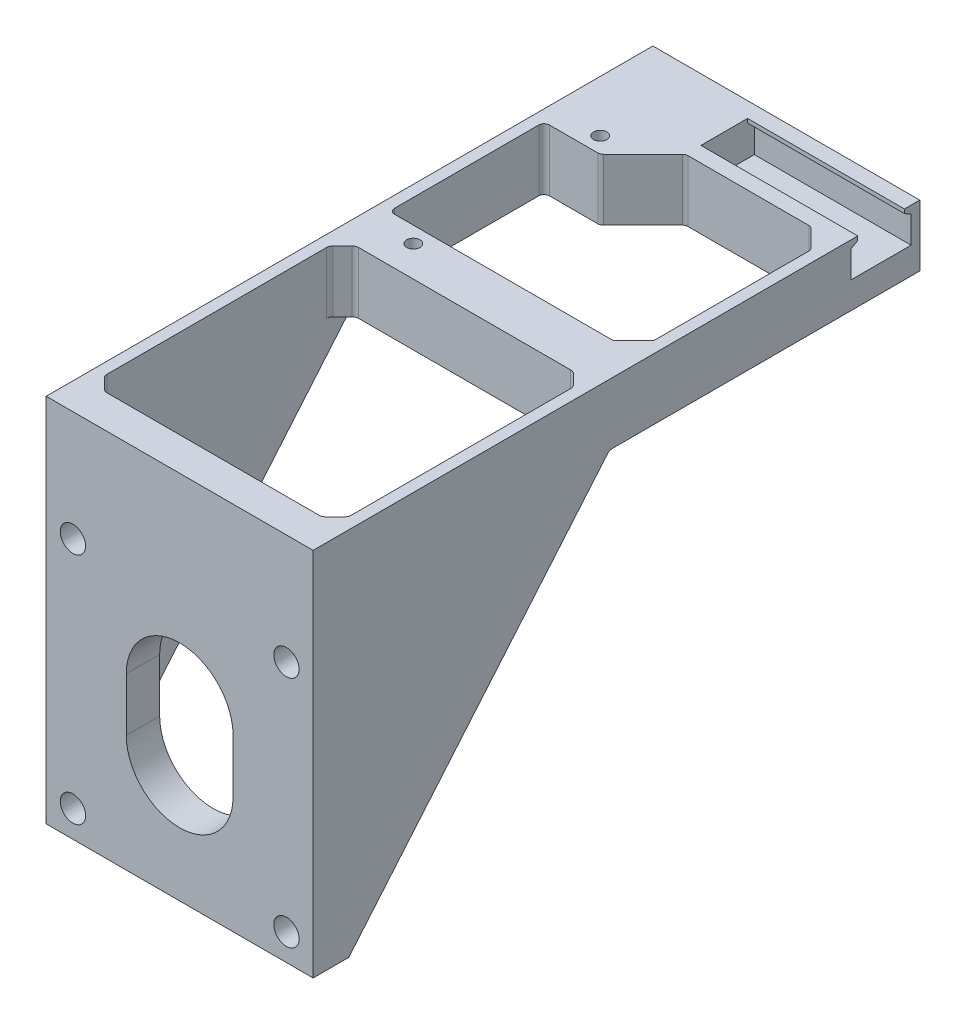
from build123d import *

# Parameters (mm, degrees)
BOSS_EXTRUDE1_START      = -1
SKETCH1_W                = 1.7
SKETCH1_H                = 89.2
BOSS_EXTRUDE1_DEPTH      = 9.2
SKETCH4_W                = 40
SKETCH4_H                = 11.6
BOSS_EXTRUDE3_DEPTH      = 9.2
SERVO_HOLDER_DEPTH       = 1
SERVO_HOLDER_DEPTH_BACK  = 9.2
SKETCH3_W                = 14
SKETCH3_H                = 7
SKETCH3_R                = 1
SKETCH37_W               = 26
SKETCH37_H               = 7
BOSS_EXTRUDE19_DEPTH     = 10.2
CUT_EXTRUDE10_DEPTH      = 93.482268571
CUT_EXTRUDE10_DEPTH_BACK = 93.482268571
SKETCH29_W               = 49.101454262
SKETCH29_H               = 5.977389624
BOSS_EXTRUDE17_DEPTH     = 3
SKETCH39_W               = 1.7
SKETCH39_H               = 41.2
BOSS_EXTRUDE20_DEPTH     = 9.2
CUT_EXTRUDE13_DEPTH      = 23.5
CHAMFER2_SIZE            = 0.6
CHAMFER2_SIZE_2          = 1.039230485
CHAMFER3_SIZE            = 3
CHAMFER4_SIZE            = 2.5
CUT_EXTRUDE16_DEPTH      = 10
FILLET11_R               = 0.8
SKETCH51_W               = 40
SKETCH51_H               = 41
CUT_EXTRUDE17_DEPTH      = 10
SKETCH50_W               = 40
SKETCH50_H               = 55.5
SKETCH50_R               = 1.9
BOSS_EXTRUDE24_DEPTH     = 5
SKETCH53_W               = 1.7
SKETCH53_H               = 37.711538462
BOSS_EXTRUDE25_DEPTH     = 9.2
CHAMFER6_START           = -21.7
CHAMFER6_DEPTH           = 1.7
CHAMFER6_START_2         = 16.6
CHAMFER6_2_DEPTH         = 1.7
CHAMFER5_SIZE            = 2
FILLET13_R               = 1


with BuildPart() as part:
    # Sketch1 → Boss-Extrude1 (new body)
    with BuildSketch(Plane(origin=(0, 0, 0), x_dir=(1, 0, 0), z_dir=(0, 1, 0)).offset(BOSS_EXTRUDE1_START)):
        with Locations((-20.85, 25.311538462)):
            Rectangle(SKETCH1_W, SKETCH1_H)
    extrude(amount=-BOSS_EXTRUDE1_DEPTH)

    # Sketch4 → Boss-Extrude3 (add)
    with BuildSketch(Plane.XZ.offset(10.2)):
        with Locations((-1.7, -64.111538462)):
            Rectangle(SKETCH4_W, SKETCH4_H)
    extrude(amount=-BOSS_EXTRUDE3_DEPTH)

    # Sketch3 → Servo Holder (add, two sides: drawn at the far end of the back side and taken through both)
    # profile 1 of 2: a face of its own
    with BuildSketch(Plane.XZ.offset(10.2).offset(-SERVO_HOLDER_DEPTH_BACK)):
        with Locations((-14.7, -55.411538462)):
            Rectangle(SKETCH3_W, SKETCH3_H)
        with Locations(Location((-14, -54.311538462, 0), (0, 0, 270))):
            Circle(SKETCH3_R, mode=Mode.SUBTRACT)
    # profile 2 of 2: a face of its own
    with BuildSketch(Plane.XZ.offset(10.2).offset(-SERVO_HOLDER_DEPTH_BACK)):
        with Locations((-14.7, -25.211538462)):
            Rectangle(SKETCH3_W, SKETCH3_H)
        with Locations(Location((-14, -26.311538462, 0), (0, 0, 90))):
            Circle(SKETCH3_R, mode=Mode.SUBTRACT)
    extrude(amount=SERVO_HOLDER_DEPTH + SERVO_HOLDER_DEPTH_BACK)

    # Sketch37 → Boss-Extrude19 (add)
    with BuildSketch(Plane(origin=(0, -1, 0), x_dir=(1, 0, 0), z_dir=(0, 1, 0))):
        with Locations((5.3, 25.211538462)):
            Rectangle(SKETCH37_W, SKETCH37_H)
    extrude(amount=-BOSS_EXTRUDE19_DEPTH)

    # Sketch29 → Cut-Extrude10 (cut, two sides: drawn at the far end of the back side and taken through both)
    with BuildSketch(Plane(origin=(0, 0, -69.911538462), x_dir=(-1, 0, 0), z_dir=(0, 0, -1)).offset(-CUT_EXTRUDE10_DEPTH_BACK)):
        with Locations((-2.850727131, -13.188694812)):
            Rectangle(SKETCH29_W, SKETCH29_H)
    extrude(amount=CUT_EXTRUDE10_DEPTH + CUT_EXTRUDE10_DEPTH_BACK, mode=Mode.SUBTRACT)

    # Sketch35 → Boss-Extrude17 (add)
    with BuildSketch(Plane(origin=(18.3, 0, 0), x_dir=(0, 0, -1), z_dir=(1, 0, 0))):
        Polygon((-2, -1), (21.711538462, -1), (21.711538462, -10.2), (-19.288461538, -10.2), (-19.288461538, -1), align=None)
    extrude(amount=-BOSS_EXTRUDE17_DEPTH)

    # Sketch39 → Boss-Extrude20 (add)
    with BuildSketch(Plane(origin=(0, -1, 0), x_dir=(1, 0, 0), z_dir=(0, 1, 0))):
        with Locations((17.45, 49.311538462)):
            Rectangle(SKETCH39_W, SKETCH39_H)
    extrude(amount=-BOSS_EXTRUDE20_DEPTH)

    # Sketch40 → Cut-Extrude13 (cut)
    with BuildSketch(Plane(origin=(18.3, 0, 0), x_dir=(0, 0, -1), z_dir=(1, 0, 0))):
        Polygon((64.111538462, -1), (60.611538462, -1), (60.611538462, -2.2), (59.611538462, -2.2), (59.611538462, -6.2), (64.111538462, -6.2), align=None)
        Polygon((67.611538462, -1), (64.111538462, -1), (64.111538462, -6.2), (68.611538462, -6.2), (68.611538462, -2.2), (67.611538462, -2.2), align=None)
    extrude(amount=-CUT_EXTRUDE13_DEPTH, mode=Mode.SUBTRACT)

    # Chamfer2
    # the kernel refuses this chamfer: 1.039230485, 0.6 mm, written as the material it takes off along each edge
    with BuildSketch(Plane(origin=(20.988578382, -2.2, -60.611538462), x_dir=(0, 1, 0), z_dir=(-1, 0, 0))) as chamfer2_piece_1_section:
        Polygon((CHAMFER2_SIZE, 0), (0, -CHAMFER2_SIZE_2), (0, 0), align=None)
    chamfer2_piece_1 = extrude(amount=26.188578382, mode=Mode.PRIVATE)
    chamfer2_piece_1 = split(chamfer2_piece_1, bisect_by=Plane(origin=(20.988578382, -2.2, -59.611538462), z_dir=(0, 0, -1)), keep=Keep.TOP, mode=Mode.PRIVATE)
    add(chamfer2_piece_1, mode=Mode.SUBTRACT)
    with BuildSketch(Plane(origin=(20.988578382, -2.2, -67.611538462), x_dir=(0, 1, 0), z_dir=(-1, 0, 0))) as chamfer2_piece_2_section:
        Polygon((CHAMFER2_SIZE, 0), (0, CHAMFER2_SIZE_2), (0, 0), align=None)
    chamfer2_piece_2 = extrude(amount=26.188578382, mode=Mode.PRIVATE)
    chamfer2_piece_2 = split(chamfer2_piece_2, bisect_by=Plane(origin=(20.988578382, -2.2, -68.611538462), z_dir=(0, 0, 1)), keep=Keep.TOP, mode=Mode.PRIVATE)
    add(chamfer2_piece_2, mode=Mode.SUBTRACT)

    # Chamfer3
    chamfer3_edges = [part.edges().sort_by_distance(p)[0] for p in [
        (16.6, -5.6, -58.311538462),
        (16.6, -5.6, -28.711538462),
    ]]
    chamfer(chamfer3_edges, length=CHAMFER3_SIZE)

    # Chamfer4
    chamfer4_edges = [part.edges().sort_by_distance(p)[0] for p in [
        (-7.7, -5.6, -58.311538462),
    ]]
    chamfer(chamfer4_edges, length=CHAMFER4_SIZE)

    # Sketch43 → Cut-Extrude16 (cut)
    with BuildSketch(Plane(origin=(0, -1, 0), x_dir=(1, 0, 0), z_dir=(0, 1, 0))):
        Polygon((-5.2, 58.311538462), (-11.6, 51.911538462), (-5.2, 51.911538462), align=None)
    extrude(amount=-CUT_EXTRUDE16_DEPTH, mode=Mode.SUBTRACT)

    # Fillet11
    fillet11_edges = [part.edges().sort_by_distance(p)[0] for p in [
        (16.6, -5.6, -55.311538462),
        (16.6, -5.6, -31.711538462),
        (13.6, -5.6, -28.711538462),
        (13.6, -5.6, -58.311538462),
        (-5.2, -5.6, -58.311538462),
        (-11.6, -5.6, -51.911538462),
        (-20, -5.6, -51.911538462),
        (-20, -5.6, -28.711538462),
    ]]
    fillet(fillet11_edges, radius=FILLET11_R)

    # Sketch51 → Cut-Extrude17 (cut)
    with BuildSketch(Plane(origin=(0, -1, 0), x_dir=(1, 0, 0), z_dir=(0, 1, 0))):
        with Locations((-1.7, 1.211538462)):
            Rectangle(SKETCH51_W, SKETCH51_H)
    extrude(amount=-CUT_EXTRUDE17_DEPTH, mode=Mode.SUBTRACT)



with BuildPart() as body_2:
    # Sketch50 → Boss-Extrude24 (new body)
    with BuildSketch(Plane.XY.offset(16)):
        with Locations((-1.7, -28.75)):
            Rectangle(SKETCH50_W, SKETCH50_H)
        with Locations((-17.7, -17.5)):
            Circle(SKETCH50_R, mode=Mode.SUBTRACT)
        with Locations(Location((14.3, -17.5, 0), (0, 0, 180))):
            Circle(SKETCH50_R, mode=Mode.SUBTRACT)
        with Locations((14.3, -52.5)):
            Circle(SKETCH50_R, mode=Mode.SUBTRACT)
        with Locations(Location((-17.7, -52.5, 0), (0, 0, 180))):
            Circle(SKETCH50_R, mode=Mode.SUBTRACT)
        with BuildLine():
            Line((6.3, -31), (6.3, -39))
            ThreePointArc((6.3, -39), (-1.7, -47), (-9.7, -39))
            Line((-9.7, -39), (-9.7, -31))
            ThreePointArc((-9.7, -31), (-1.7, -23), (6.3, -31))
        make_face(mode=Mode.SUBTRACT)
    extrude(amount=BOSS_EXTRUDE24_DEPTH)


with BuildPart() as part_1:
    add(part.part)

    add(body_2.part)  # Boss-Extrude25 merges body 2
    # Sketch53 → Boss-Extrude25 (add)
    with BuildSketch(Plane(origin=(0, -1, 0), x_dir=(1, 0, 0), z_dir=(0, 1, 0))):
        with Locations((17.45, 2.855769231)):
            Rectangle(SKETCH53_W, SKETCH53_H)
        with Locations((-20.85, 2.855769231)):
            Rectangle(SKETCH53_W, SKETCH53_H)
    extrude(amount=-BOSS_EXTRUDE25_DEPTH)

    # Chamfer6: read off the stored shape, not the designer's step
    # Chamfer6 outline → Chamfer6 (add)
    with BuildSketch(Plane.YZ.offset(CHAMFER6_START)):
        Polygon((-56.5, 16), (-56.5, 15.662571698), (-10.2, -23.394754297), (-10.2, 16), align=None)
    extrude(amount=CHAMFER6_DEPTH)

    # Chamfer6 2 outline → Chamfer6 2 (add)
    with BuildSketch(Plane.YZ.offset(CHAMFER6_START_2)):
        Polygon((-56.5, 16), (-56.5, 15.662571698), (-10.2, -23.394754297), (-10.2, 16), align=None)
    extrude(amount=CHAMFER6_2_DEPTH)

    # Chamfer5
    # the kernel refuses this chamfer: 2 mm, written as the material it adds along each edge
    with BuildSketch(Plane(origin=(16.6, -1, -21.711538462), x_dir=(-1, 0, 0), z_dir=(0, -1, 0)), Plane(origin=(-20, -1, -21.711538462), x_dir=(0, 0, 1), z_dir=(0, -1, 0))) as chamfer5_piece_1:
        Polygon((CHAMFER5_SIZE, 0), (0, -CHAMFER5_SIZE), (0, 0), align=None)
    extrude(amount=9.2)
    with BuildSketch(Plane(origin=(16.6, -56.5, 16), x_dir=(-1, 0, 0), z_dir=(0, 1, 0))) as chamfer5_piece_2_section:
        Polygon((CHAMFER5_SIZE, 0), (0, -CHAMFER5_SIZE), (0, 0), align=None)
    chamfer5_piece_2 = extrude(amount=55.5, mode=Mode.PRIVATE)
    chamfer5_piece_2 = chamfer5_piece_2 - Plane(origin=(14.3, -52.5, 16), x_dir=(1, 0, 0), z_dir=(0, 0, -1)) * Cylinder(1.9, 119, mode=Mode.PRIVATE)
    chamfer5_piece_2 = chamfer5_piece_2 - Plane(origin=(14.3, -17.5, 16), x_dir=(-1, 0, 0), z_dir=(0, 0, -1)) * Cylinder(1.9, 119, mode=Mode.PRIVATE)
    chamfer5_piece_2 = split(chamfer5_piece_2, bisect_by=Plane(origin=(16.6, -56.666302124, 15.802859306), z_dir=(0, 0.6447909042653838, 0.7643590058190123)), keep=Keep.TOP, mode=Mode.PRIVATE)
    add(chamfer5_piece_2)
    with BuildSketch(Plane(origin=(-20, -56.5, 16), x_dir=(1, 0, 0), z_dir=(0, 1, 0))) as chamfer5_piece_3_section:
        Polygon((CHAMFER5_SIZE, 0), (0, CHAMFER5_SIZE), (0, 0), align=None)
    chamfer5_piece_3 = extrude(amount=55.5, mode=Mode.PRIVATE)
    chamfer5_piece_3 = chamfer5_piece_3 - Plane(origin=(-17.7, -52.5, 16), x_dir=(-1, 0, 0), z_dir=(0, 0, -1)) * Cylinder(1.9, 119, mode=Mode.PRIVATE)
    chamfer5_piece_3 = chamfer5_piece_3 - Plane(origin=(-17.7, -17.5, 16), x_dir=(1, 0, 0), z_dir=(0, 0, -1)) * Cylinder(1.9, 119, mode=Mode.PRIVATE)
    chamfer5_piece_3 = split(chamfer5_piece_3, bisect_by=Plane(origin=(-20, -56.666302124, 15.802859306), z_dir=(0, 0.6447909042653838, 0.7643590058190123)), keep=Keep.TOP, mode=Mode.PRIVATE)
    add(chamfer5_piece_3)

    # Fillet13
    # the kernel refuses this fillet: 1 mm, written as the material it adds along each edge
    with BuildSketch(Plane(origin=(16.6, -55.564659873, 14), x_dir=(-0.7071067811865454, 0, 0.7071067811865497), z_dir=(0, 1, 0))) as fillet13_piece_1_section:
        with BuildLine():
            CenterArc((FILLET13_R * 0.414213562373, -FILLET13_R), FILLET13_R, 90, 45)
            Line((-FILLET13_R * 0.292893218813, -FILLET13_R * 0.292893218813), (0, 0))
            Line((0, 0), (FILLET13_R * 0.414213562373, 0))
        make_face()
    fillet13_piece_1 = extrude(amount=54.564659873, mode=Mode.PRIVATE)
    fillet13_piece_1 = split(fillet13_piece_1, bisect_by=Plane(origin=(16.6, -55.134131152, 14.510364682), z_dir=(0, 0.6447909042651655, 0.7643590058191962)), keep=Keep.TOP, mode=Mode.PRIVATE)
    add(fillet13_piece_1)
    with BuildSketch(Plane(origin=(14.6, -16.659367602, 16), x_dir=(0.7071067811865475, 0, -0.7071067811865475), z_dir=(0, 1, 0))) as fillet13_piece_2_section:
        with BuildLine():
            CenterArc((FILLET13_R * 0.414213562373, FILLET13_R), FILLET13_R, 225, 45)
            Line((-FILLET13_R * 0.292893218813, FILLET13_R * 0.292893218813), (0, 0))
            Line((0, 0), (FILLET13_R * 0.414213562373, 0))
        make_face()
    fillet13_piece_2 = extrude(amount=15.659367602, mode=Mode.PRIVATE)
    fillet13_piece_2 = fillet13_piece_2 - Plane(origin=(14.3, -17.5, 16), x_dir=(-1, 0, 0), z_dir=(0, 0, -1)) * Cylinder(1.9, 33, mode=Mode.PRIVATE)
    add(fillet13_piece_2)
    with BuildSketch(Plane(origin=(14.6, -56.5, 16), x_dir=(0.7071067811865475, 0, -0.7071067811865475), z_dir=(0, 1, 0))) as fillet13_piece_3_section:
        with BuildLine():
            CenterArc((FILLET13_R * 0.414213562373, FILLET13_R), FILLET13_R, 225, 45)
            Line((-FILLET13_R * 0.292893218813, FILLET13_R * 0.292893218813), (0, 0))
            Line((0, 0), (FILLET13_R * 0.414213562373, 0))
        make_face()
    fillet13_piece_3 = extrude(amount=3.159367602, mode=Mode.PRIVATE)
    fillet13_piece_3 = fillet13_piece_3 - Plane(origin=(14.3, -52.5, 16), x_dir=(1, 0, 0), z_dir=(0, 0, -1)) * Cylinder(1.9, 8, mode=Mode.PRIVATE)
    add(fillet13_piece_3)
    with BuildSketch(Plane(origin=(16.6, -1, -19.711538462), x_dir=(0, 0, 1), z_dir=(0, -1, 0)), Plane(origin=(-18, -1, -21.711538462), x_dir=(1.0, 0, -1.0978572219633363e-12), z_dir=(0, -1, 0)), Plane(origin=(-20, -1, -19.711538462), x_dir=(0.7071067811865475, 0, -0.7071067811865475), z_dir=(0, -1, 0))) as fillet13_piece_4:
        with BuildLine():
            CenterArc((FILLET13_R * 0.414213562373, FILLET13_R), FILLET13_R, 225, 45)
            Line((-FILLET13_R * 0.292893218813, FILLET13_R * 0.292893218813), (0, 0))
            Line((0, 0), (FILLET13_R * 0.414213562373, 0))
        make_face()
    extrude(amount=9.2)
    with BuildSketch(Plane(origin=(14.6, -1, -21.711538462), x_dir=(-1.0, 0, -1.0978572219633363e-12), z_dir=(0, -1, 0))) as fillet13_piece_5:
        with BuildLine():
            CenterArc((FILLET13_R * 0.414213562372, -FILLET13_R), FILLET13_R, 90, 45)
            Line((-FILLET13_R * 0.292893218814, -FILLET13_R * 0.292893218813), (0, 0))
            Line((0, 0), (FILLET13_R * 0.414213562373, 0))
        make_face()
    extrude(amount=9.2)
    with BuildSketch(Plane(origin=(-18, -56.5, 16), x_dir=(-0.7071067811865475, 0, -0.7071067811865475), z_dir=(0, 1, 0))) as fillet13_piece_6_section:
        with BuildLine():
            CenterArc((FILLET13_R * 0.414213562373, -FILLET13_R), FILLET13_R, 90, 45)
            Line((-FILLET13_R * 0.292893218813, -FILLET13_R * 0.292893218813), (0, 0))
            Line((0, 0), (FILLET13_R * 0.414213562373, 0))
        make_face()
    fillet13_piece_6 = extrude(amount=3.159367602, mode=Mode.PRIVATE)
    fillet13_piece_6 = fillet13_piece_6 - Plane(origin=(-17.7, -52.5, 16), x_dir=(-1, 0, 0), z_dir=(0, 0, -1)) * Cylinder(1.9, 8, mode=Mode.PRIVATE)
    add(fillet13_piece_6)
    with BuildSketch(Plane(origin=(-18, -16.659367602, 16), x_dir=(-0.7071067811865475, 0, -0.7071067811865475), z_dir=(0, 1, 0))) as fillet13_piece_7_section:
        with BuildLine():
            CenterArc((FILLET13_R * 0.414213562373, -FILLET13_R), FILLET13_R, 90, 45)
            Line((-FILLET13_R * 0.292893218813, -FILLET13_R * 0.292893218813), (0, 0))
            Line((0, 0), (FILLET13_R * 0.414213562373, 0))
        make_face()
    fillet13_piece_7 = extrude(amount=15.659367602, mode=Mode.PRIVATE)
    fillet13_piece_7 = fillet13_piece_7 - Plane(origin=(-17.7, -17.5, 16), x_dir=(1, 0, 0), z_dir=(0, 0, -1)) * Cylinder(1.9, 33, mode=Mode.PRIVATE)
    add(fillet13_piece_7)
    with BuildSketch(Plane(origin=(-20, -55.564659873, 14), x_dir=(0.7071067811865475, 0, 0.7071067811865475), z_dir=(0, 1, 0))) as fillet13_piece_8_section:
        with BuildLine():
            CenterArc((FILLET13_R * 0.414213562373, FILLET13_R), FILLET13_R, 225, 45)
            Line((-FILLET13_R * 0.292893218813, FILLET13_R * 0.292893218813), (0, 0))
            Line((0, 0), (FILLET13_R * 0.414213562373, 0))
        make_face()
    fillet13_piece_8 = extrude(amount=54.564659873, mode=Mode.PRIVATE)
    fillet13_piece_8 = split(fillet13_piece_8, bisect_by=Plane(origin=(-20, -55.134131152, 14.510364682), z_dir=(0, 0.6447909042651655, 0.7643590058191962)), keep=Keep.TOP, mode=Mode.PRIVATE)
    add(fillet13_piece_8)
    with BuildSketch(Plane(origin=(16.6, -10.2, -23.394754297), x_dir=(0, 0, -1), z_dir=(1, 0, 0)), Plane(origin=(-21.7, -10.2, -23.394754297), x_dir=(0, 0, -1), z_dir=(1, 0, 0))) as fillet13_piece_9:
        with BuildLine():
            CenterArc((FILLET13_R * 0.464715000429, -FILLET13_R), FILLET13_R, 90, 49.85)
            Line((-FILLET13_R * 0.29964400539, -FILLET13_R * 0.355209095735), (0, 0))
            Line((0, 0), (FILLET13_R * 0.464715000429, 0))
        make_face()
    extrude(amount=1.7)
    with BuildSketch(Plane(origin=(-18, -51.659367602, 16), x_dir=(-0.7071067811865475, 0, -0.7071067811865475), z_dir=(0, 1, 0))) as fillet13_piece_10_section:
        with BuildLine():
            CenterArc((FILLET13_R * 0.414213562373, -FILLET13_R), FILLET13_R, 90, 45)
            Line((-FILLET13_R * 0.292893218813, -FILLET13_R * 0.292893218813), (0, 0))
            Line((0, 0), (FILLET13_R * 0.414213562373, 0))
        make_face()
    fillet13_piece_10 = extrude(amount=33.318735204, mode=Mode.PRIVATE)
    fillet13_piece_10 = fillet13_piece_10 - Plane(origin=(-17.7, -17.5, 16), x_dir=(1, 0, 0), z_dir=(0, 0, -1)) * Cylinder(1.9, 69, mode=Mode.PRIVATE)
    fillet13_piece_10 = fillet13_piece_10 - Plane(origin=(-17.7, -52.5, 16), x_dir=(-1, 0, 0), z_dir=(0, 0, -1)) * Cylinder(1.9, 69, mode=Mode.PRIVATE)
    add(fillet13_piece_10)
    with BuildSketch(Plane(origin=(14.6, -51.659367602, 16), x_dir=(0.7071067811865475, 0, -0.7071067811865475), z_dir=(0, 1, 0))) as fillet13_piece_11_section:
        with BuildLine():
            CenterArc((FILLET13_R * 0.414213562373, FILLET13_R), FILLET13_R, 225, 45)
            Line((-FILLET13_R * 0.292893218813, FILLET13_R * 0.292893218813), (0, 0))
            Line((0, 0), (FILLET13_R * 0.414213562373, 0))
        make_face()
    fillet13_piece_11 = extrude(amount=33.318735204, mode=Mode.PRIVATE)
    fillet13_piece_11 = fillet13_piece_11 - Plane(origin=(14.3, -52.5, 16), x_dir=(1, 0, 0), z_dir=(0, 0, -1)) * Cylinder(1.9, 69, mode=Mode.PRIVATE)
    fillet13_piece_11 = fillet13_piece_11 - Plane(origin=(14.3, -17.5, 16), x_dir=(-1, 0, 0), z_dir=(0, 0, -1)) * Cylinder(1.9, 69, mode=Mode.PRIVATE)
    add(fillet13_piece_11)


solid = part_1.part
